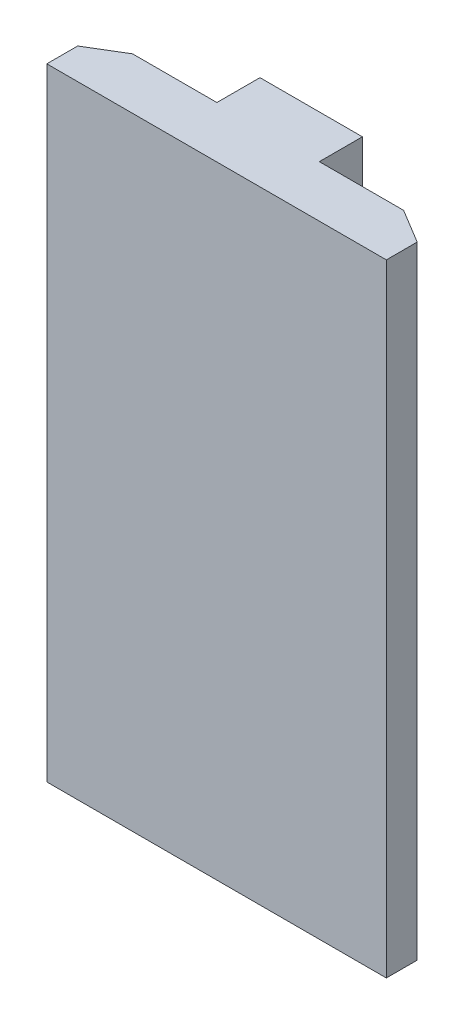
from build123d import *

# Parameters (mm, degrees)
HOUSING_DEPTH = 302.4


with BuildPart() as part:
    # housing sketch → housing (new, symmetric)
    with BuildSketch(Plane(origin=(0, 0, 0), x_dir=(1, 0, 0), z_dir=(0, 1, 0))):
        Polygon((165.1, 0), (165.1, 30), (131.795345671, 50.1), (49.8, 50.1), (49.8, 92), (-49.8, 92), (-49.8, 50.1), (-131.795345671, 50.1), (-165.1, 30), (-165.1, 0), align=None)
    extrude(amount=HOUSING_DEPTH, both=True)


solid = part.part
